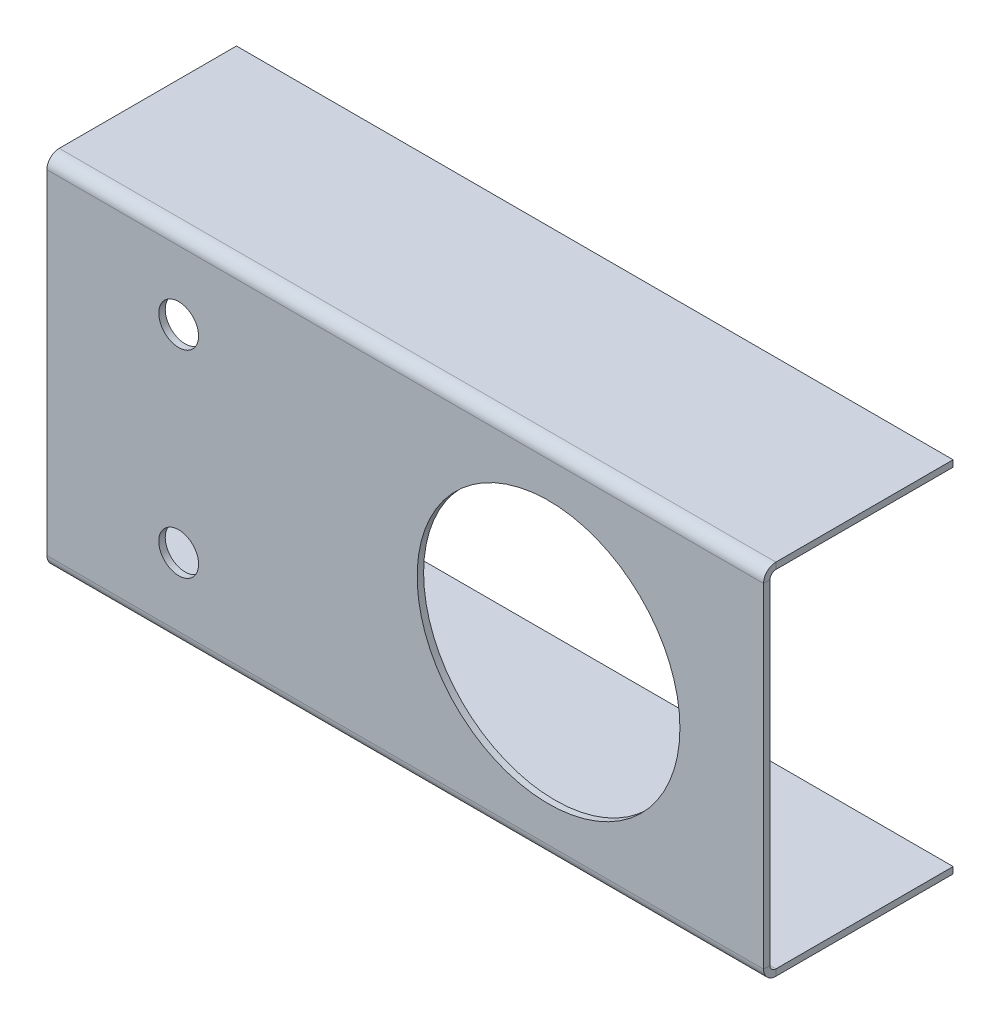
from build123d import *

# Parameters (mm, degrees)
SKETCH1_W                    = 90
SKETCH1_H                    = 45.05
BASE_FLANGE1_DEPTH           = 0.81
EDGE_FLANGE1_STRIP_W         = 4.7132
EDGE_FLANGE1_STRIP_H         = 0.81
EDGE_FLANGE1_STRIP_CUT_DEPTH = 90
EDGE_FLANGE1_DEPTH           = 90
EDGE_FLANGE2_STRIP_W         = 4.7132
EDGE_FLANGE2_STRIP_H         = 0.81
EDGE_FLANGE2_STRIP_CUT_DEPTH = 90
EDGE_FLANGE2_DEPTH           = 90
SKETCH9_R                    = 16.5
SKETCH9_R_2                  = 2.5
CUT_EXTRUDE1_DEPTH           = 10


# Sheet-metal steps are written as plain solids
with BuildPart() as part:
    # Sketch1 → Base-Flange1 (new body)
    with BuildSketch(Plane.XY):
        with Locations((45, 22.525)):
            Rectangle(SKETCH1_W, SKETCH1_H)
    extrude(amount=-BASE_FLANGE1_DEPTH)

    # Edge-Flange1 strip (across the edge) → Edge-Flange1 strip cut (cut)
    with BuildSketch(Plane(origin=(0, 45.05, -0.81), x_dir=(0, -1, 0), z_dir=(1, 0, 0))):
        with Locations((-0.81, -0.405)):
            Rectangle(EDGE_FLANGE1_STRIP_W, EDGE_FLANGE1_STRIP_H)
    extrude(amount=EDGE_FLANGE1_STRIP_CUT_DEPTH, mode=Mode.SUBTRACT)

    # Edge-Flange1 section (across the edge) → Edge-Flange1 (add)
    with BuildSketch(Plane(origin=(0, 45.05, -0.81), x_dir=(0, -1, 0), z_dir=(1, 0, 0))):
        with BuildLine():
            Line((0, 0.7366), (0, 23))
            Line((0, 23), (0.81, 23))
            Line((0.81, 23), (0.81, 0.7366))
            ThreePointArc((0.81, 0.7366), (1.025745145, 0.215745145), (1.5466, 0))
            Line((1.5466, 0), (1.5466, -0.81))
            ThreePointArc((1.5466, -0.81), (0.452988652, -0.357011348), (0, 0.7366))
        make_face()
    extrude(amount=EDGE_FLANGE1_DEPTH)

    # Edge-Flange2 strip (across the edge) → Edge-Flange2 strip cut (cut)
    with BuildSketch(Plane(origin=(90, 0, -0.81), x_dir=(0, 1, 0), z_dir=(-1, 0, 0))):
        with Locations((-0.81, -0.405)):
            Rectangle(EDGE_FLANGE2_STRIP_W, EDGE_FLANGE2_STRIP_H)
    extrude(amount=EDGE_FLANGE2_STRIP_CUT_DEPTH, mode=Mode.SUBTRACT)

    # Edge-Flange2 section (across the edge) → Edge-Flange2 (add)
    with BuildSketch(Plane(origin=(90, 0, -0.81), x_dir=(0, 1, 0), z_dir=(-1, 0, 0))):
        with BuildLine():
            Line((0, 0.7366), (0, 23))
            Line((0, 23), (0.81, 23))
            Line((0.81, 23), (0.81, 0.7366))
            ThreePointArc((0.81, 0.7366), (1.025745145, 0.215745145), (1.5466, 0))
            Line((1.5466, 0), (1.5466, -0.81))
            ThreePointArc((1.5466, -0.81), (0.452988652, -0.357011348), (0, 0.7366))
        make_face()
    extrude(amount=EDGE_FLANGE2_DEPTH)

    # Sketch9 → Cut-Extrude1 (cut)
    with BuildSketch(Plane.XY):
        with Locations((63, 22.525)):
            Circle(SKETCH9_R)
        with Locations((16.55327865, 10.12)):
            Circle(SKETCH9_R_2)
        with Locations((16.55327865, 34.93)):
            Circle(SKETCH9_R_2)
    extrude(amount=-CUT_EXTRUDE1_DEPTH, mode=Mode.SUBTRACT)


solid = part.part
